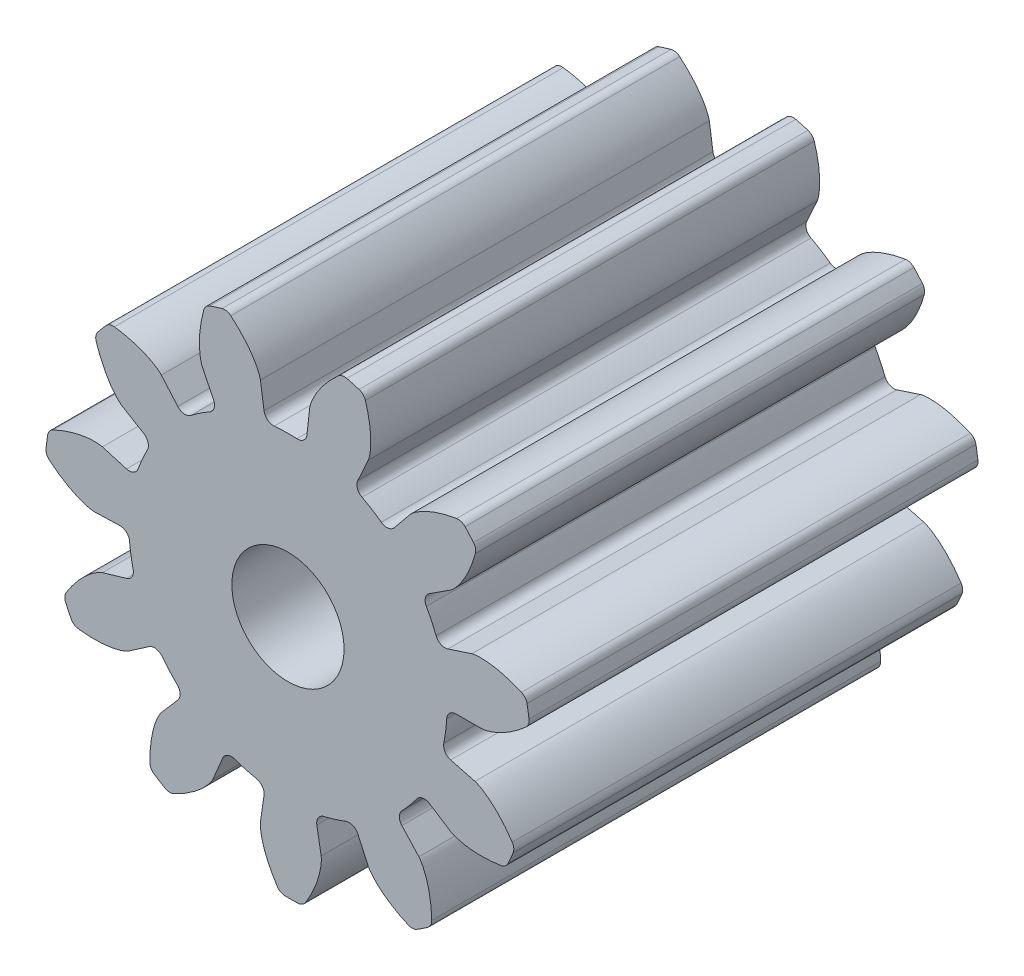
from build123d import *

# Parameters (mm, degrees)
SKETCH1_R                = 3.25
BOSS_EXTRUDE1_DEPTH      = 6
CUT_EXTRUDE3_START       = -6
CUT_EXTRUDE3_DEPTH       = 6
FILLET1_R                = 0.127
FILLET2_R                = 0.127
CIRPATTERN3_COUNT        = 11
FILLET1_OF_CIRPATTERN3_R = 0.127
FILLET2_OF_CIRPATTERN3_R = 0.127
SKETCH5_R                = 0.75
CUT_EXTRUDE4_DEPTH       = 7.212


# Read off the part's stored shape, not the designer's step: Cut-Extrude3
with BuildPart() as part:
    # Sketch1 → Boss-Extrude1 (new body)
    with BuildSketch(Plane.XY):
        Circle(SKETCH1_R)
    extrude(amount=-BOSS_EXTRUDE1_DEPTH)

    # Cut-Extrude3 outline → Cut-Extrude3 (cut)
    with BuildSketch(Plane.XY.offset(CUT_EXTRUDE3_START)):
        with BuildLine():
            add(Edge.make_bspline(
                [(3.033669345, -1.165911792), (3.033140846, -1.165053041), (3.022379522, -1.147592466), (3.00088722, -1.113733109), (2.967750412, -1.064926002), (2.921326378, -1.002096369), (2.873142207, -0.943066321), (2.828545831, -0.893339721), (2.78870947, -0.852754), (2.754415977, -0.820270411), (2.725357298, -0.794435319), (2.695448532, -0.769538585), (2.664675947, -0.745748585), (2.6330213, -0.723187079), (2.603129158, -0.703808974), (2.575243557, -0.687451776), (2.551005768, -0.674725974), (2.531877617, -0.665715329), (2.51656576, -0.659395159), (2.507033325, -0.655925741), (2.501913642, -0.654340318), (2.500075557, -0.653817835)],
                knots=[0.380296348, 0.380296348, 0.380296348, 0.380296348, 0.380296348, 0.383126635, 0.43785898, 0.492591256, 0.547323565, 0.602055884, 0.652783571, 0.680149903, 0.707515961, 0.734882063, 0.762248421, 0.789614741, 0.816980391, 0.844236067, 0.862480777, 0.880559096, 0.894007228, 0.903714168, 0.909090916, 0.909090916, 0.909090916, 0.909090916, 0.909090916], degree=4))
            ThreePointArc((3.033669345, -1.165911792), (3.223455757, -0.414527422), (3.229952323, 0.360427511))
            add(Edge.make_bspline(
                [(2.584154707, 0), (2.586065181, 4.0429e-05), (2.591419417, 0.000278935), (2.601519499, 0.001223666), (2.617932231, 0.003464143), (2.638717807, 0.007341993), (2.665386744, 0.013521332), (2.696503587, 0.022290981), (2.730326007, 0.033475571), (2.766659019, 0.047294053), (2.80244949, 0.06252423), (2.837684262, 0.079043687), (2.872334021, 0.096686051), (2.913730411, 0.119436132), (2.962539245, 0.148622328), (3.018265958, 0.185447659), (3.079817601, 0.230365987), (3.140627708, 0.279405609), (3.185035066, 0.318240752), (3.214394852, 0.345560672), (3.229223747, 0.359730417), (3.229952323, 0.360427511)],
                knots=[0, 0, 0, 0, 0, 0.005376748, 0.015083688, 0.02853182, 0.046610139, 0.064854849, 0.092110525, 0.119476175, 0.146842495, 0.174208853, 0.201574955, 0.228941013, 0.256307345, 0.307035032, 0.361767351, 0.41649966, 0.471231936, 0.525964281, 0.528794568, 0.528794568, 0.528794568, 0.528794568, 0.528794568], degree=4))
            Line((2.584154707, 0), (2.125, 0))
            ThreePointArc((2.125, 0), (2.107644149, -0.271037161), (2.055860101, -0.537646951))
            Line((2.055860101, -0.537646951), (2.500075557, -0.653817835))
        make_face()
    cut_extrude3 = extrude(amount=CUT_EXTRUDE3_DEPTH, mode=Mode.SUBTRACT)

    # Fillet1
    fillet1_edges = [part.edges().sort_by_distance(p)[0] for p in [
        (2.055860101, -0.537646951, -3),
        (2.125, 0, -3),
    ]]
    fillet(fillet1_edges, radius=FILLET1_R)

    # Fillet2
    fillet2_edges = [part.edges().sort_by_distance(p)[0] for p in [
        (3.229952323, 0.360427511, -3),
        (3.033669345, -1.165911792, -3),
    ]]
    fillet(fillet2_edges, radius=FILLET2_R)

    # CirPattern3: Cut-Extrude3 ×11 about axis
    cirpattern3_axis = Axis((0, 0, -6), (0, 0, 1))
    for i in range(1, CIRPATTERN3_COUNT):
        add(cut_extrude3.rotate(cirpattern3_axis, i * 360 / CIRPATTERN3_COUNT), mode=Mode.SUBTRACT)

    # Fillet1 of CirPattern3
    fillet1_of_cirpattern3_edges = [part.edges().sort_by_distance(p)[0] for p in [
        (2.02017346, 0.659184489, -3),
        (1.787663757, 1.148861737, -3),
        (1.343096019, 1.646729511, -3),
        (0.882756903, 1.93296799, -3),
        (0.239595082, 2.111449548, -3),
        (-0.302419031, 2.103370564, -3),
        (-0.9399756, 1.905799273, -3),
        (-1.39157906, 1.605967846, -3),
        (-1.821110671, 1.095071195, -3),
        (-2.038922569, 0.598681683, -3),
        (-2.124055972, -0.063334251, -3),
        (-2.038922569, -0.598681683, -3),
        (-1.752628509, -1.201631519, -3),
        (-1.39157906, -1.605967846, -3),
        (-0.824753878, -1.958419271, -3),
        (-0.302419031, -2.103370564, -3),
        (0.364974282, -2.093422741, -3),
        (0.882756903, -1.93296799, -3),
        (1.438825686, -1.563779283, -3),
        (1.787663757, -1.148861737, -3),
    ]]
    fillet(fillet1_of_cirpattern3_edges, radius=FILLET1_OF_CIRPATTERN3_R)

    # Fillet2 of CirPattern3
    fillet2_of_cirpattern3_edges = [part.edges().sort_by_distance(p)[0] for p in [
        (2.522346978, 2.049454981, -3),
        (3.182424558, 0.659298061, -3),
        (1.01391429, 3.087794976, -3),
        (2.32078246, 2.275185437, -3),
        (-0.816429021, 3.145781883, -3),
        (0.722308329, 3.168717513, -3),
        (-2.387561887, 2.205005269, -3),
        (-1.105493593, 3.056204168, -3),
        (-3.200660723, 0.564155062, -3),
        (-2.582309111, 1.973367593, -3),
        (-2.997572395, -1.255810391, -3),
        (-3.239259731, 0.264000751, -3),
        (-1.842776011, -2.677064918, -3),
        (-2.867768274, -1.529184464, -3),
        (-0.102911264, -3.248370248, -3),
        (-1.585780653, -2.836864417, -3),
        (1.669627082, -2.788340977, -3),
        (0.199681121, -3.243859962, -3),
        (2.912070627, -1.443033147, -3),
        (1.92174555, -2.620952889, -3),
    ]]
    fillet(fillet2_of_cirpattern3_edges, radius=FILLET2_OF_CIRPATTERN3_R)

    # Sketch5 → Cut-Extrude4 (cut)
    with BuildSketch(Plane.XY):
        Circle(SKETCH5_R)
    extrude(amount=-CUT_EXTRUDE4_DEPTH, mode=Mode.SUBTRACT)


solid = part.part
